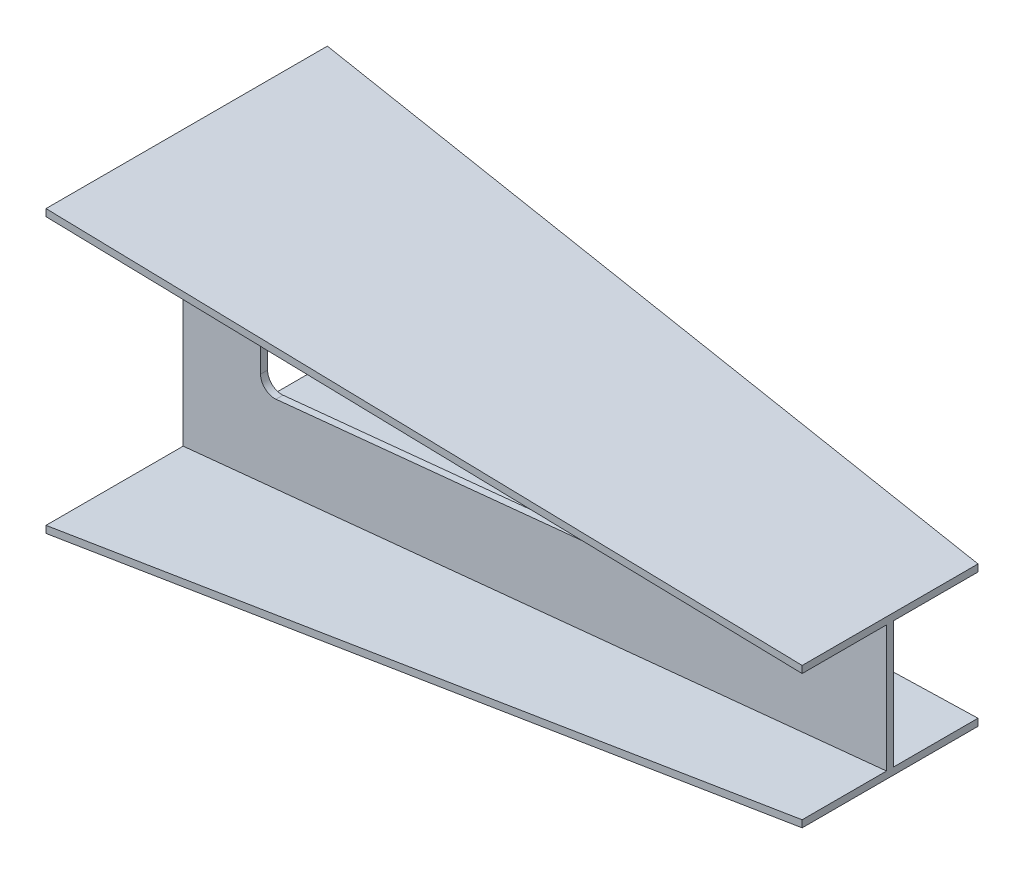
from build123d import *

# Parameters (mm, degrees)
CUT_EXTRUDE1_DEPTH = 1041.20430699


with BuildPart() as part:
    # Sketch1 → Loft4 section 0
    with BuildSketch(Plane(origin=(0, 0, 0), x_dir=(0, 0, -1), z_dir=(1, 0, 0))):
        with BuildLine():
            Line((-205, 200), (195, 200))
            Line((195, 200), (195, 190))
            Line((195, 190), (0, 190))
            Line((0, 190), (0, -190))
            Line((0, -190), (195, -190))
            Line((195, -190), (195, -200))
            Line((195, -200), (-205, -200))
            Line((-205, -200), (-205, -190))
            Line((-205, -190), (-10, -190))
            Line((-10, -190), (-10, 190))
            Line((-10, 190), (-205, 190))
            Line((-205, 190), (-205, 200))
        make_face()
    # Sketch4 → Loft4 section 1
    with BuildSketch(Plane(origin=(1000, 0, -1000), x_dir=(0, 0, 1), z_dir=(-1, 0, 0))):
        with BuildLine():
            Line((880, 100), (1130, 100))
            Line((1130, 100), (1130, 90))
            Line((1130, 90), (1010, 90))
            Line((1010, 90), (1010, -90))
            Line((1010, -90), (1130, -90))
            Line((1130, -90), (1130, -100))
            Line((1130, -100), (880, -100))
            Line((880, -100), (880, -90))
            Line((880, -90), (1000, -90))
            Line((1000, -90), (1000, 90))
            Line((1000, 90), (880, 90))
            Line((880, 90), (880, 100))
        make_face()
    loft()

    # Sketch5 → Cut-Extrude1 (cut, through all)
    with BuildSketch(Plane.XY.offset(10)):
        with BuildLine():
            Line((131.99007438, -66.25236073), (595.506243635, -19.900743804))
            ThreePointArc((595.506243635, -19.900743804), (613.516169254, 0), (595.506243635, 19.900743804))
            Line((595.506243635, 19.900743804), (131.99007438, 66.25236073))
            ThreePointArc((131.99007438, 66.25236073), (116.579893585, 61.180667596), (110, 46.351616925))
            Line((110, 46.351616925), (110, -46.351616925))
            ThreePointArc((110, -46.351616925), (116.579893585, -61.180667596), (131.99007438, -66.25236073))
        make_face()
    extrude(amount=-CUT_EXTRUDE1_DEPTH, mode=Mode.SUBTRACT)


solid = part.part
